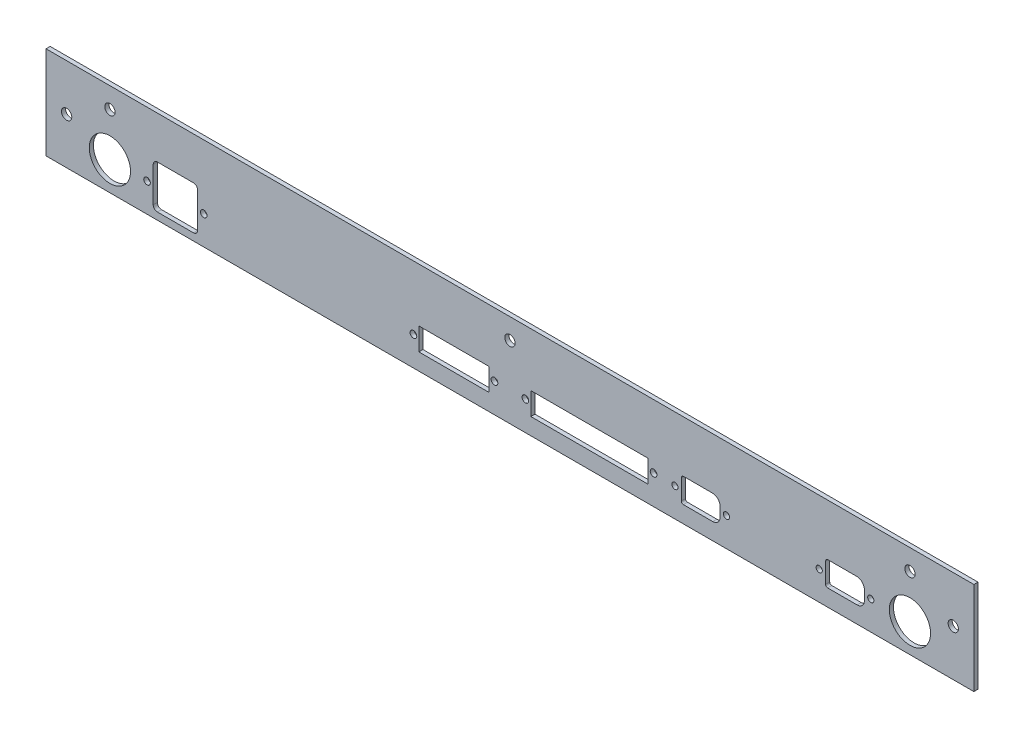
from build123d import *

# Parameters (mm, degrees)
SKETCH1_W                      = 450
SKETCH1_H                      = 45
BOSS_EXTRUDE1_DEPTH            = 2
TERMINAL_12P_CUTOUT_DEPTH      = 227.131046077
TERMINAL_12P_CUTOUT_DEPTH_BACK = 227.131046077
SK_TERMINAL_12P_CUTOUT_R       = 1.625
SK_TERMINAL_12P_CUTOUT_W       = 56.92
SK_TERMINAL_12P_CUTOUT_H       = 10.9
SK_TERMINAL_12P_CUTOUT_W_2     = 34.06
SKETCH2_R                      = 2.5
CUT_EXTRUDE1_DEPTH             = 227.131046077
SKETCH3_R                      = 1.5
SKETCH3_R_2                    = 10
SKETCH3_R_3                    = 1.6
CUT_EXTRUDE2_DEPTH             = 10


with BuildPart() as part:
    # Sketch1 → Boss-Extrude1 (new body)
    with BuildSketch(Plane.XY):
        Rectangle(SKETCH1_W, SKETCH1_H)
    extrude(amount=BOSS_EXTRUDE1_DEPTH)

    # SK Terminal 12P cutout → Terminal 12P cutout (cut, two sides: drawn at the far end of the back side and taken through both)
    with BuildSketch(Plane.XY.offset(-TERMINAL_12P_CUTOUT_DEPTH_BACK)):
        with Locations((7.5, -8.35)):
            Circle(SK_TERMINAL_12P_CUTOUT_R)
        with Locations((69.67, -8.35)):
            Circle(SK_TERMINAL_12P_CUTOUT_R)
        with Locations((-46.81, -8.35)):
            Circle(SK_TERMINAL_12P_CUTOUT_R)
        with Locations((-7.5, -8.35)):
            Circle(SK_TERMINAL_12P_CUTOUT_R)
        with Locations((38.585, -8.95)):
            Rectangle(SK_TERMINAL_12P_CUTOUT_W, SK_TERMINAL_12P_CUTOUT_H)
        with Locations((-27.155, -8.95)):
            Rectangle(SK_TERMINAL_12P_CUTOUT_W_2, SK_TERMINAL_12P_CUTOUT_H)
    extrude(amount=TERMINAL_12P_CUTOUT_DEPTH + TERMINAL_12P_CUTOUT_DEPTH_BACK, mode=Mode.SUBTRACT)

    # Sketch2 → Cut-Extrude1 (cut, through all)
    with BuildSketch(Plane.XY.offset(2)):
        with Locations((-215, 0)):
            Circle(SKETCH2_R)
        with Locations((215, 0)):
            Circle(SKETCH2_R)
        with Locations((-194, 12.495407459)):
            Circle(SKETCH2_R)
        with Locations((194, 12.495407459)):
            Circle(SKETCH2_R)
        with Locations((0, 12.5)):
            Circle(SKETCH2_R)
    extrude(amount=-CUT_EXTRUDE1_DEPTH, mode=Mode.SUBTRACT)

    # Sketch3 → Cut-Extrude2 (cut)
    with BuildSketch(Plane.XY.offset(2)):
        with Locations((150, -8.55)):
            Circle(SKETCH3_R)
        with Locations((175, -8.55)):
            Circle(SKETCH3_R)
        with Locations((80, -8.55)):
            Circle(SKETCH3_R)
        with Locations((105, -8.55)):
            Circle(SKETCH3_R)
        with Locations((194, -8.55)):
            Circle(SKETCH3_R_2)
        with Locations((-194, -8.55)):
            Circle(SKETCH3_R_2)
        with Locations((-176, -8.55)):
            Circle(SKETCH3_R_3)
        with Locations((-148.5, -8.55)):
            Circle(SKETCH3_R_3)
        with BuildLine():
            Line((168.375, -14.4), (154.1, -14.4))
            ThreePointArc((154.1, -14.4), (153.392893219, -14.107106781), (153.1, -13.4))
            Line((153.1, -13.4), (153.1, -3.7))
            ThreePointArc((153.1, -3.7), (153.451471863, -2.851471863), (154.3, -2.5))
            Line((154.3, -2.5), (168.175, -2.5))
            ThreePointArc((168.175, -2.5), (170.80897276, -3.59102724), (171.9, -6.225))
            Line((171.9, -6.225), (171.9, -10.875))
            ThreePointArc((171.9, -10.875), (170.867551404, -13.367551404), (168.375, -14.4))
        make_face()
        with BuildLine():
            Line((98.375, -14.4), (84.1, -14.4))
            ThreePointArc((84.1, -14.4), (83.392893219, -14.107106781), (83.1, -13.4))
            Line((83.1, -13.4), (83.1, -3.7))
            ThreePointArc((83.1, -3.7), (83.451471863, -2.851471863), (84.3, -2.5))
            Line((84.3, -2.5), (98.175, -2.5))
            ThreePointArc((98.175, -2.5), (100.80897276, -3.59102724), (101.9, -6.225))
            Line((101.9, -6.225), (101.9, -10.875))
            ThreePointArc((101.9, -10.875), (100.867551404, -13.367551404), (98.375, -14.4))
        make_face()
        with BuildLine():
            Line((-171, -19.05), (-153.5, -19.05))
            ThreePointArc((-153.5, -19.05), (-152.085786438, -18.464213562), (-151.5, -17.05))
            Line((-151.5, -17.05), (-151.5, -0.05))
            ThreePointArc((-151.5, -0.05), (-152.085786438, 1.364213562), (-153.5, 1.95))
            Line((-153.5, 1.95), (-171, 1.95))
            ThreePointArc((-171, 1.95), (-172.414213562, 1.364213562), (-173, -0.05))
            Line((-173, -0.05), (-173, -17.05))
            ThreePointArc((-173, -17.05), (-172.414213562, -18.464213562), (-171, -19.05))
        make_face()
    extrude(amount=-CUT_EXTRUDE2_DEPTH, mode=Mode.SUBTRACT)


solid = part.part
